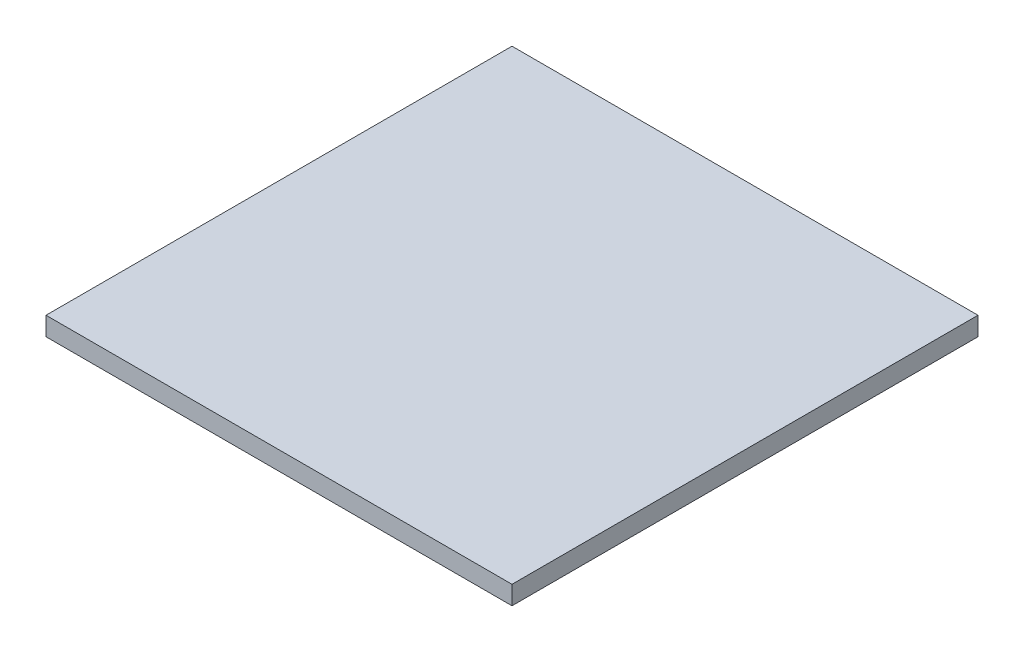
from build123d import *

# Parameters (mm, degrees)
ESQUISSE1_W        = 250
ESQUISSE1_H        = 250
BOSS_EXTRU_1_DEPTH = 10


with BuildPart() as part:
    # Esquisse1 → Boss.-Extru.1 (new body)
    with BuildSketch(Plane(origin=(0, 0, 0), x_dir=(1, 0, 0), z_dir=(0, 1, 0))):
        Rectangle(ESQUISSE1_W, ESQUISSE1_H)
    extrude(amount=BOSS_EXTRU_1_DEPTH)


solid = part.part
